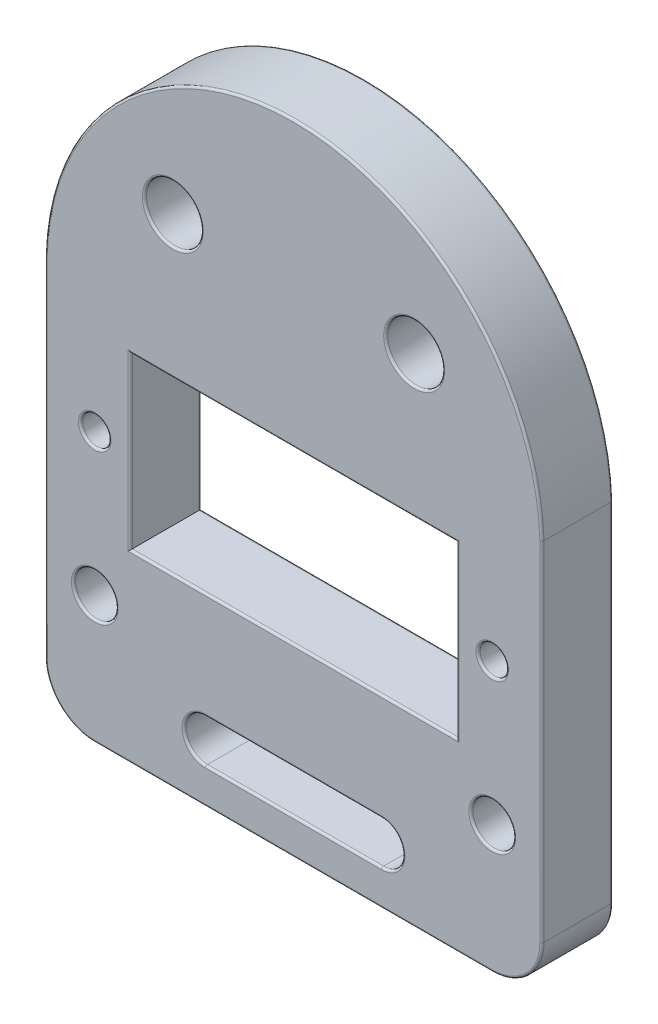
from build123d import *

# Parameters (mm, degrees)
SZKIC1_R                    = 1
SZKIC1_R_2                  = 1.5
SZKIC1_R_3                  = 2
SZKIC1_W                    = 23
SZKIC1_H                    = 12
DODANIE_WYCI_GNI_CIE1_DEPTH = 5
ZAOKR_GLENIE1_R             = 3.5
ZAOKR_GLENIE2_R             = 0.15


with BuildPart() as part:
    # Szkic1 → Dodanie-wyciągnięcie1 (new body)
    with BuildSketch(Plane.XY):
        with BuildLine():
            Line((-17.5, 9), (-17.5, -19))
            Line((-17.5, -19), (17.5, -19))
            Line((17.5, -19), (17.5, 9))
            ThreePointArc((17.5, 9), (0, 26), (-17.5, 9))
        make_face()
        with Locations((-14, 0)):
            Circle(SZKIC1_R, mode=Mode.SUBTRACT)
        with Locations((-14, -10)):
            Circle(SZKIC1_R_2, mode=Mode.SUBTRACT)
        with Locations((-8.5, 16)):
            Circle(SZKIC1_R_3, mode=Mode.SUBTRACT)
        with Locations((14, -10)):
            Circle(SZKIC1_R_2, mode=Mode.SUBTRACT)
        with Locations((14, 0)):
            Circle(SZKIC1_R, mode=Mode.SUBTRACT)
        with Locations((8.5, 16)):
            Circle(SZKIC1_R_3, mode=Mode.SUBTRACT)
        Rectangle(SZKIC1_W, SZKIC1_H, mode=Mode.SUBTRACT)
        with BuildLine():
            Line((-6.2, -13.5), (6.2, -13.5))
            ThreePointArc((6.2, -13.5), (7.7, -15), (6.2, -16.5))
            Line((6.2, -16.5), (-6.2, -16.5))
            ThreePointArc((-6.2, -16.5), (-7.7, -15), (-6.2, -13.5))
        make_face(mode=Mode.SUBTRACT)
    extrude(amount=DODANIE_WYCI_GNI_CIE1_DEPTH)

    # Zaokrąglenie1
    zaokr_glenie1_edges = [part.edges().sort_by_distance(p)[0] for p in [
        (-17.5, -19, 2.5),
        (17.5, -19, 2.5),
    ]]
    fillet(zaokr_glenie1_edges, radius=ZAOKR_GLENIE1_R)

    # Zaokrąglenie2
    zaokr_glenie2_edges = [part.edges().sort_by_distance(p)[0] for p in [
        (6.5, 16, 0),
        (12.5, -10, 0),
        (7.7, -15, 0),
        (0, -16.5, 0),
        (-7.7, -15, 0),
        (0, -13.5, 0),
        (-15.5, -10, 0),
        (-11.5, 0, 0),
        (0, 6, 0),
        (11.5, 0, 0),
        (0, -6, 0),
        (16.474873734, -17.974873734, 0),
        (17.5, -3.25, 0),
        (0, 26, 0),
        (-17.5, -3.25, 0),
        (-16.474873734, -17.974873734, 0),
        (0, -19, 0),
        (-15, 0, 0),
        (-10.5, 16, 0),
        (13, 0, 0),
        (6.5, 16, 5),
        (13, 0, 5),
        (12.5, -10, 5),
        (-10.5, 16, 5),
        (0, -16.5, 5),
        (7.7, -15, 5),
        (0, -13.5, 5),
        (-7.7, -15, 5),
        (0, 26, 5),
        (17.5, -3.25, 5),
        (16.474873734, -17.974873734, 5),
        (0, -19, 5),
        (-16.474873734, -17.974873734, 5),
        (-17.5, -3.25, 5),
        (0, 6, 5),
        (-11.5, 0, 5),
        (0, -6, 5),
        (11.5, 0, 5),
        (-15, 0, 5),
        (-15.5, -10, 5),
    ]]
    fillet(zaokr_glenie2_edges, radius=ZAOKR_GLENIE2_R)


solid = part.part
